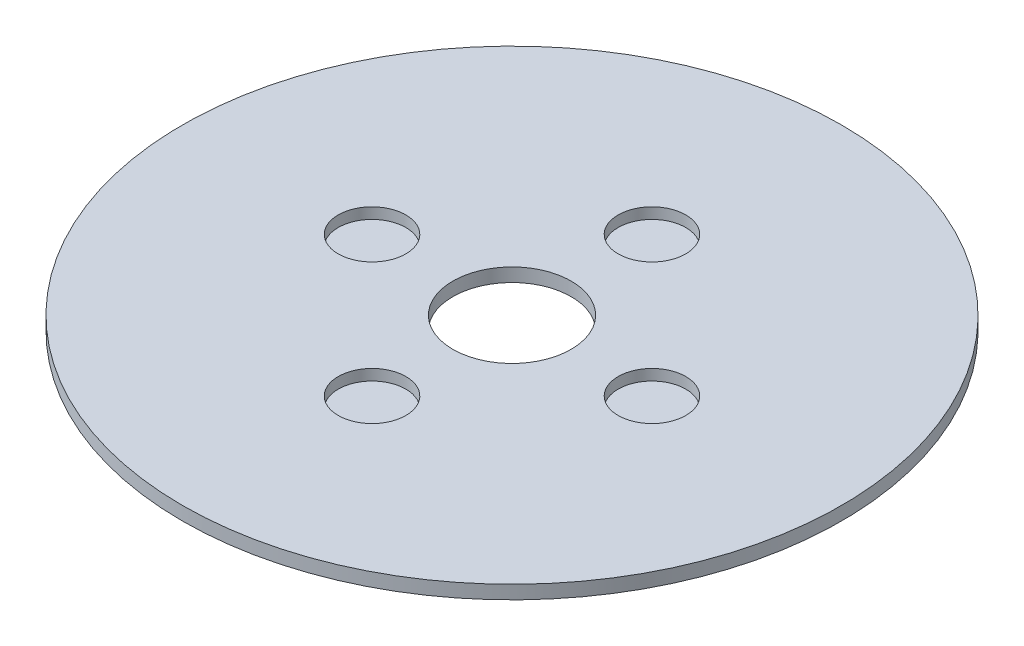
from build123d import *

# Parameters (mm, degrees)
SKETCH1_R           = 97.5
BOSS_EXTRUDE1_DEPTH = 4
SKETCH2_R           = 17.5
CUT_EXTRUDE1_DEPTH  = 138.943829148
SKETCH3_R           = 10
CUT_EXTRUDE2_DEPTH  = 3.236726861
CIRPATTERN1_COUNT   = 4


with BuildPart() as part:
    # Sketch1 → Boss-Extrude1 (new body)
    with BuildSketch(Plane(origin=(0, 0, 0), x_dir=(1, 0, 0), z_dir=(0, 1, 0))):
        Circle(SKETCH1_R)
    extrude(amount=BOSS_EXTRUDE1_DEPTH)

    # Sketch2 → Cut-Extrude1 (cut, through all)
    with BuildSketch(Plane(origin=(0, 0, 0), x_dir=(1, 0, 0), z_dir=(0, 1, 0))):
        Circle(SKETCH2_R)
    extrude(amount=CUT_EXTRUDE1_DEPTH, mode=Mode.SUBTRACT)

    # Sketch3 → Cut-Extrude2 (cut)
    with BuildSketch(Plane(origin=(0, 4, 0), x_dir=(1, 0, 0), z_dir=(0, 1, 0))):
        with Locations((-41.408550115, 0)):
            Circle(SKETCH3_R)
    cut_extrude2 = extrude(amount=-CUT_EXTRUDE2_DEPTH, mode=Mode.SUBTRACT)

    # CirPattern1: Cut-Extrude2 ×4 about axis
    cirpattern1_axis = Axis((0, 0, 0), (0, 1, 0))
    for i in range(1, CIRPATTERN1_COUNT):
        add(cut_extrude2.rotate(cirpattern1_axis, i * 360 / CIRPATTERN1_COUNT), mode=Mode.SUBTRACT)


solid = part.part
